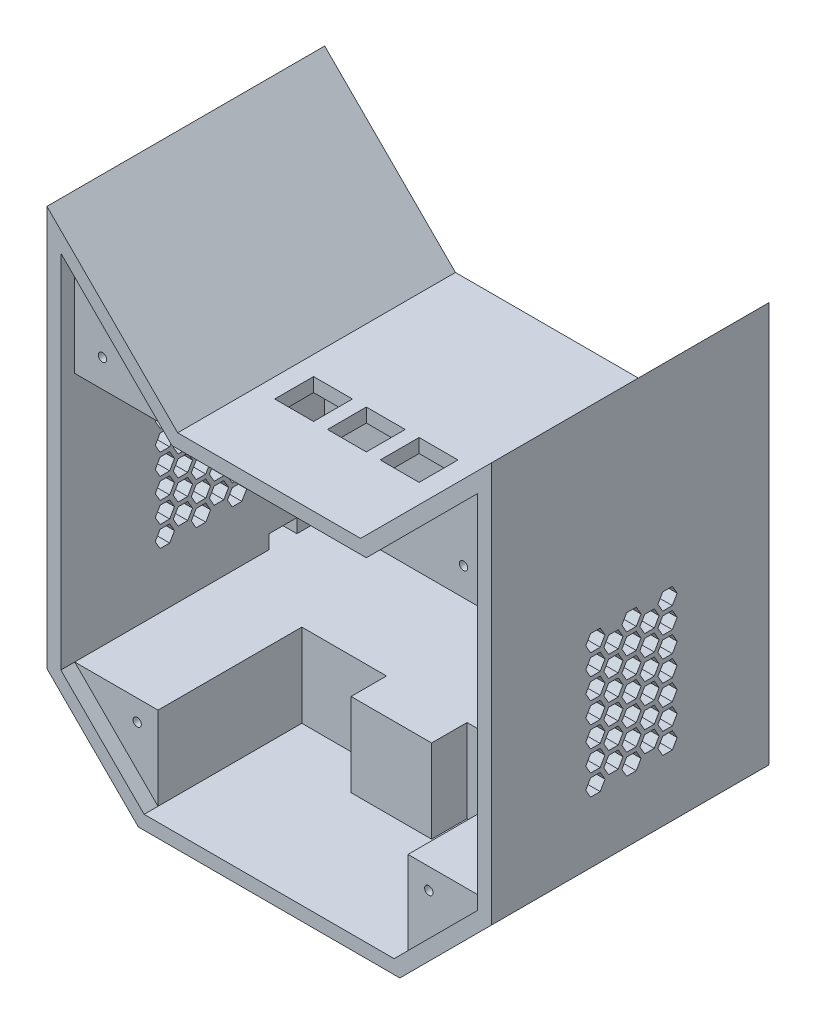
from build123d import *

# Parameters (mm, degrees)
Y_KSEKLIK_EKSTR_ZYON1_DEPTH = 100
Y_KSEKLIK_EKSTR_ZYON2_DEPTH = 5
Y_KSEKLIK_EKSTR_ZYON3_DEPTH = 90
KES_EKSTR_ZYON6_DEPTH       = 5
DOLGU_START                 = -80
DOLGU_DESENI1_DEPTH         = 5
IZIM12_W                    = 14
IZIM12_H                    = 14
KES_EKSTR_ZYON7_DEPTH       = 17
IZIM16_W                    = 160
IZIM16_H                    = 23.284271248
IZIM16_H_2                  = 23.284271247
KES_EKSTR_ZYON12_DEPTH      = 23.5
IZIM17_W                    = 90
IZIM17_H                    = 15
Y_KSEKLIK_EKSTR_ZYON4_DEPTH = 30
Y_KSEKLIK_EKSTR_ZYON5_DEPTH = 90
IZIM19_W                    = 29
IZIM19_H                    = 12.765981284
Y_KSEKLIK_EKSTR_ZYON6_DEPTH = 30
IZIM22_R                    = 1.5
KES_EKSTR_ZYON14_DEPTH      = 10
IZIM23_W                    = 10
IZIM23_H                    = 5
KES_EKSTR_ZYON17_DEPTH      = 15


# Read off the part's stored shape, not the designer's step: Dolgu Deseni1
with BuildPart() as part:
    # Çizim1 → Yükseklik-Ekstrüzyon1 (new body)
    with BuildSketch(Plane.XY):
        Polygon((-35, 60), (0, 60), (0, 65), (-32.928932188, 65), (-80, 112.071067812), (-80, -32.071067812), (-47.071067812, -65), (0, -65), (0, -60), (-45, -60), (-75, -30), (-75, 60), (-75, 100), align=None)
        Polygon((0, 60), (35, 60), (75, 100), (75, 60), (75, -30), (45, -60), (0, -60), (0, -65), (47.071067812, -65), (80, -32.071067812), (80, 112.071067812), (32.928932188, 65), (0, 65), align=None)
    extrude(amount=-Y_KSEKLIK_EKSTR_ZYON1_DEPTH)

    # Çizim2 → Yükseklik-Ekstrüzyon2 (add)
    with BuildSketch(Plane(origin=(0, 0, -100), x_dir=(-1, 0, 0), z_dir=(0, 0, -1))):
        Polygon((35, 60), (-35, 60), (-75, 60), (-75, -30), (-45, -60), (45, -60), (75, -30), (75, 60), align=None)
        Polygon((-35, 60), (-75, 100), (-75, 60), align=None)
        Polygon((75, 100), (35, 60), (75, 60), align=None)
    extrude(amount=-Y_KSEKLIK_EKSTR_ZYON2_DEPTH)

    # Çizim3 → Yükseklik-Ekstrüzyon3 (add)
    with BuildSketch(Plane.XY.offset(-95)):
        Polygon((-75, 60), (-35, 60), (-75, 100), align=None)
        Polygon((75, 100), (35, 60), (75, 60), align=None)
        Polygon((75, -30), (45, -30), (45, -60), align=None)
        Polygon((-45, -60), (-45, -30), (-75, -30), align=None)
    extrude(amount=Y_KSEKLIK_EKSTR_ZYON3_DEPTH)

    # Çizim10 → Kes-Ekstrüzyon6 (cut)
    with BuildSketch(Plane(origin=(-75, 0, 0), x_dir=(0, 0, -1), z_dir=(1, 0, 0))):
        Polygon((40.924101615, 38), (39.192050808, 41), (35.727949192, 41), (33.995898385, 38), (35.727949192, 35), (39.192050808, 35), align=None)
    kes_ekstr_zyon6 = extrude(amount=-KES_EKSTR_ZYON6_DEPTH, mode=Mode.SUBTRACT)

    # Dolgu Deseni1 outline → Dolgu Deseni1 (cut)
    with BuildSketch(Plane.YZ.offset(DOLGU_START)):
        Polygon((38, -59.976660498), (35, -61.708711306), (35, -65.172812921), (38, -66.904863729), (41, -65.172812921), (41, -61.708711306), align=None)
        Polygon((38, -46.986279442), (35, -48.718330249), (35, -52.182431864), (38, -53.914482672), (41, -52.182431864), (41, -48.718330249), align=None)
        Polygon((7.25, -55.213520778), (4.25, -53.48146997), (1.25, -55.213520778), (1.25, -58.677622393), (4.25, -60.4096732), (7.25, -58.677622393), align=None)
        Polygon((-4, -61.708711306), (-7, -59.976660498), (-10, -61.708711306), (-10, -65.172812921), (-7, -66.904863729), (-4, -65.172812921), align=None)
        Polygon((18.5, -48.718330249), (15.5, -46.986279442), (12.5, -48.718330249), (12.5, -52.182431864), (15.5, -53.914482672), (18.5, -52.182431864), align=None)
        Polygon((29.75, -42.223139721), (26.75, -40.491088913), (23.75, -42.223139721), (23.75, -45.687241336), (26.75, -47.419292144), (29.75, -45.687241336), align=None)
        Polygon((1.25, -42.223139721), (1.25, -45.687241336), (4.25, -47.419292144), (7.25, -45.687241336), (7.25, -42.223139721), (4.25, -40.491088913), align=None)
        Polygon((-10, -35.727949192), (-10, -39.192050808), (-7, -40.924101615), (-4, -39.192050808), (-4, -35.727949192), (-7, -33.995898385), align=None)
        Polygon((23.75, -55.213520778), (23.75, -58.677622393), (26.75, -60.4096732), (29.75, -58.677622393), (29.75, -55.213520778), (26.75, -53.48146997), align=None)
        Polygon((5, -35.727949192), (5, -39.192050808), (8, -40.924101615), (11, -39.192050808), (11, -35.727949192), (8, -33.995898385), align=None)
        Polygon((27.5, -48.718330249), (27.5, -52.182431864), (30.5, -53.914482672), (33.5, -52.182431864), (33.5, -48.718330249), (30.5, -46.986279442), align=None)
        Polygon((16.25, -42.223139721), (16.25, -45.687241336), (19.25, -47.419292144), (22.25, -45.687241336), (22.25, -42.223139721), (19.25, -40.491088913), align=None)
        Polygon((8, -59.976660498), (5, -61.708711306), (5, -65.172812921), (8, -66.904863729), (11, -65.172812921), (11, -61.708711306), align=None)
        Polygon((8, -46.986279442), (5, -48.718330249), (5, -52.182431864), (8, -53.914482672), (11, -52.182431864), (11, -48.718330249), align=None)
        Polygon((-0.25, -42.223139721), (-3.25, -40.491088913), (-6.25, -42.223139721), (-6.25, -45.687241336), (-3.25, -47.419292144), (-0.25, -45.687241336), align=None)
        Polygon((18.5, -35.727949192), (15.5, -33.995898385), (12.5, -35.727949192), (12.5, -39.192050808), (15.5, -40.924101615), (18.5, -39.192050808), align=None)
        Polygon((-4, -48.718330249), (-7, -46.986279442), (-10, -48.718330249), (-10, -52.182431864), (-7, -53.914482672), (-4, -52.182431864), align=None)
        Polygon((12.5, -61.708711306), (12.5, -65.172812921), (15.5, -66.904863729), (18.5, -65.172812921), (18.5, -61.708711306), (15.5, -59.976660498), align=None)
        Polygon((-2.5, -61.708711306), (-2.5, -65.172812921), (0.5, -66.904863729), (3.5, -65.172812921), (3.5, -61.708711306), (0.5, -59.976660498), align=None)
        Polygon((0.5, -46.986279442), (-2.5, -48.718330249), (-2.5, -52.182431864), (0.5, -53.914482672), (3.5, -52.182431864), (3.5, -48.718330249), align=None)
        Polygon((0.5, -33.995898385), (-2.5, -35.727949192), (-2.5, -39.192050808), (0.5, -40.924101615), (3.5, -39.192050808), (3.5, -35.727949192), align=None)
        Polygon((37.25, -42.223139721), (34.25, -40.491088913), (31.25, -42.223139721), (31.25, -45.687241336), (34.25, -47.419292144), (37.25, -45.687241336), align=None)
        Polygon((14.75, -55.213520778), (11.75, -53.48146997), (8.75, -55.213520778), (8.75, -58.677622393), (11.75, -60.4096732), (14.75, -58.677622393), align=None)
        Polygon((26, -48.718330249), (23, -46.986279442), (20, -48.718330249), (20, -52.182431864), (23, -53.914482672), (26, -52.182431864), align=None)
        Polygon((-6.25, -55.213520778), (-6.25, -58.677622393), (-3.25, -60.4096732), (-0.25, -58.677622393), (-0.25, -55.213520778), (-3.25, -53.48146997), align=None)
        Polygon((22.25, -55.213520778), (19.25, -53.48146997), (16.25, -55.213520778), (16.25, -58.677622393), (19.25, -60.4096732), (22.25, -58.677622393), align=None)
        Polygon((27.5, -61.708711306), (27.5, -65.172812921), (30.5, -66.904863729), (33.5, -65.172812921), (33.5, -61.708711306), (30.5, -59.976660498), align=None)
        Polygon((33.5, -35.727949192), (30.5, -33.995898385), (27.5, -35.727949192), (27.5, -39.192050808), (30.5, -40.924101615), (33.5, -39.192050808), align=None)
        Polygon((8.75, -42.223139721), (8.75, -45.687241336), (11.75, -47.419292144), (14.75, -45.687241336), (14.75, -42.223139721), (11.75, -40.491088913), align=None)
        Polygon((31.25, -55.213520778), (31.25, -58.677622393), (34.25, -60.4096732), (37.25, -58.677622393), (37.25, -55.213520778), (34.25, -53.48146997), align=None)
        Polygon((26, -35.727949192), (23, -33.995898385), (20, -35.727949192), (20, -39.192050808), (23, -40.924101615), (26, -39.192050808), align=None)
        Polygon((20, -61.708711306), (20, -65.172812921), (23, -66.904863729), (26, -65.172812921), (26, -61.708711306), (23, -59.976660498), align=None)
    dolgu_deseni1 = extrude(amount=DOLGU_DESENI1_DEPTH, mode=Mode.SUBTRACT)

    # Aynalama1: Kes-Ekstrüzyon6, Dolgu Deseni1 across plane
    add(kes_ekstr_zyon6.mirror(Plane.ZY), mode=Mode.SUBTRACT)
    add(dolgu_deseni1.mirror(Plane.ZY), mode=Mode.SUBTRACT)

    # Çizim12 → Kes-Ekstrüzyon7 (cut)
    with BuildSketch(Plane(origin=(0, 65, 0), x_dir=(1, 0, 0), z_dir=(0, 1, 0))):
        with Locations((-19.001067812, 35)):
            Rectangle(IZIM12_W, IZIM12_H)
        with Locations((-0.001067812, 35)):
            Rectangle(IZIM12_W, IZIM12_H)
        with Locations((18.998932188, 35)):
            Rectangle(IZIM12_W, IZIM12_H)
    extrude(amount=-KES_EKSTR_ZYON7_DEPTH, mode=Mode.SUBTRACT)

    # Çizim16 → Kes-Ekstrüzyon12 (cut)
    with BuildSketch(Plane(origin=(0, -82.5, -82.5), x_dir=(-1, 0, 0), z_dir=(0, -0.7071067811865475, -0.7071067811865477))):
        with Locations((0, 13.106601718)):
            Rectangle(IZIM16_W, IZIM16_H)
        with Locations((0, 36.390872966)):
            Rectangle(IZIM16_W, IZIM16_H_2)
    extrude(amount=-KES_EKSTR_ZYON12_DEPTH, mode=Mode.SUBTRACT)

    # Çizim17 → Yükseklik-Ekstrüzyon4 (add)
    with BuildSketch(Plane(origin=(0, -60, 0), x_dir=(1, 0, 0), z_dir=(0, 1, 0))):
        with Locations((0, 64.265981284)):
            Rectangle(IZIM17_W, IZIM17_H)
    extrude(amount=Y_KSEKLIK_EKSTR_ZYON4_DEPTH)

    # Çizim18 → Yükseklik-Ekstrüzyon5 (add)
    with BuildSketch(Plane(origin=(-45, 0, 0), x_dir=(0, 0, -1), z_dir=(1, 0, 0))):
        Polygon((95, -30), (71.765981284, -30), (71.765981284, -60), (95, -36.765981284), align=None)
    extrude(amount=Y_KSEKLIK_EKSTR_ZYON5_DEPTH)

    # Çizim19 → Yükseklik-Ekstrüzyon6 (add)
    with BuildSketch(Plane(origin=(0, -30, 0), x_dir=(1, 0, 0), z_dir=(0, 1, 0))):
        with Locations((0, 50.382990642)):
            Rectangle(IZIM19_W, IZIM19_H)
    extrude(amount=-Y_KSEKLIK_EKSTR_ZYON6_DEPTH)

    # Çizim22 → Kes-Ekstrüzyon14 (cut)
    with BuildSketch(Plane.XY.offset(-5)):
        with Locations((-52.5, -37.5)):
            Circle(IZIM22_R)
        with Locations((-65, 70)):
            Circle(IZIM22_R)
        with Locations(Location((52.5, -37.5, 0), (0, 0, 180))):
            Circle(IZIM22_R)
        with Locations(Location((65, 70, 0), (0, 0, 180))):
            Circle(IZIM22_R)
    extrude(amount=-KES_EKSTR_ZYON14_DEPTH, mode=Mode.SUBTRACT)

    # Çizim23 → Kes-Ekstrüzyon17 (cut)
    with BuildSketch(Plane(origin=(-75, 0, 0), x_dir=(0, 0, -1), z_dir=(1, 0, 0))):
        with Locations((80, -27.5)):
            Rectangle(IZIM23_W, IZIM23_H)
    extrude(amount=-KES_EKSTR_ZYON17_DEPTH, mode=Mode.SUBTRACT)


solid = part.part
